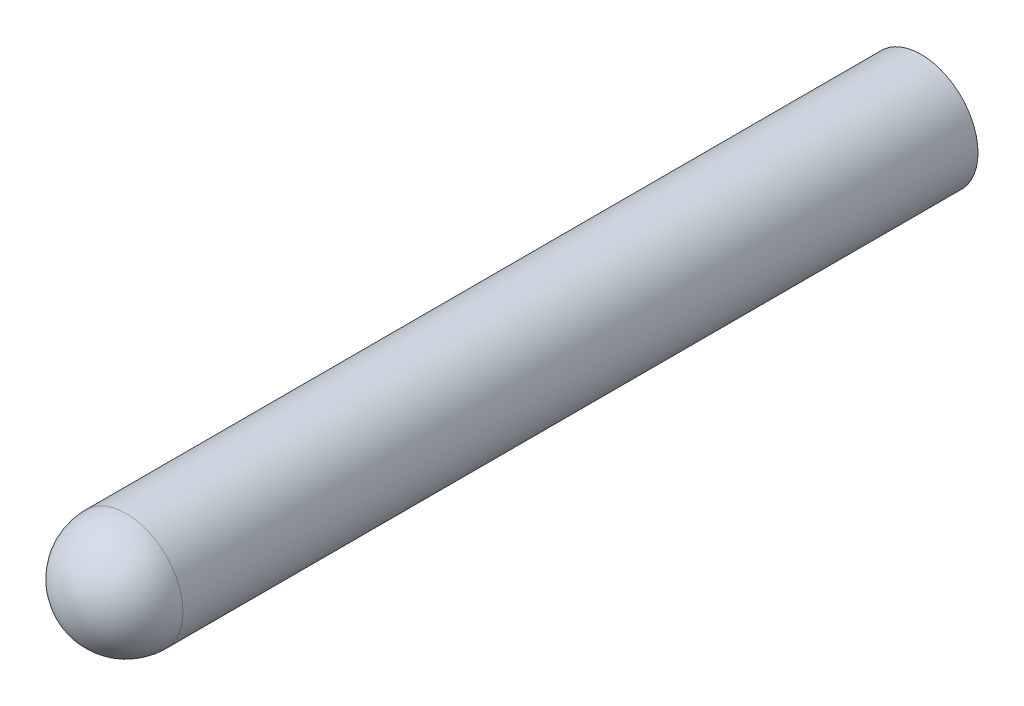
from build123d import *

# Parameters (mm, degrees)
SKETCH1_R           = 2
BOSS_EXTRUDE1_DEPTH = 30
FILLET1_R           = 2


with BuildPart() as part:
    # Sketch1 → Boss-Extrude1 (new body)
    with BuildSketch(Plane.XY):
        Circle(SKETCH1_R)
    extrude(amount=BOSS_EXTRUDE1_DEPTH)

    # Fillet1
    fillet1_edges = [part.edges().sort_by_distance(p)[0] for p in [
        (-2, 0, 30),
    ]]
    fillet(fillet1_edges, radius=FILLET1_R)


solid = part.part
